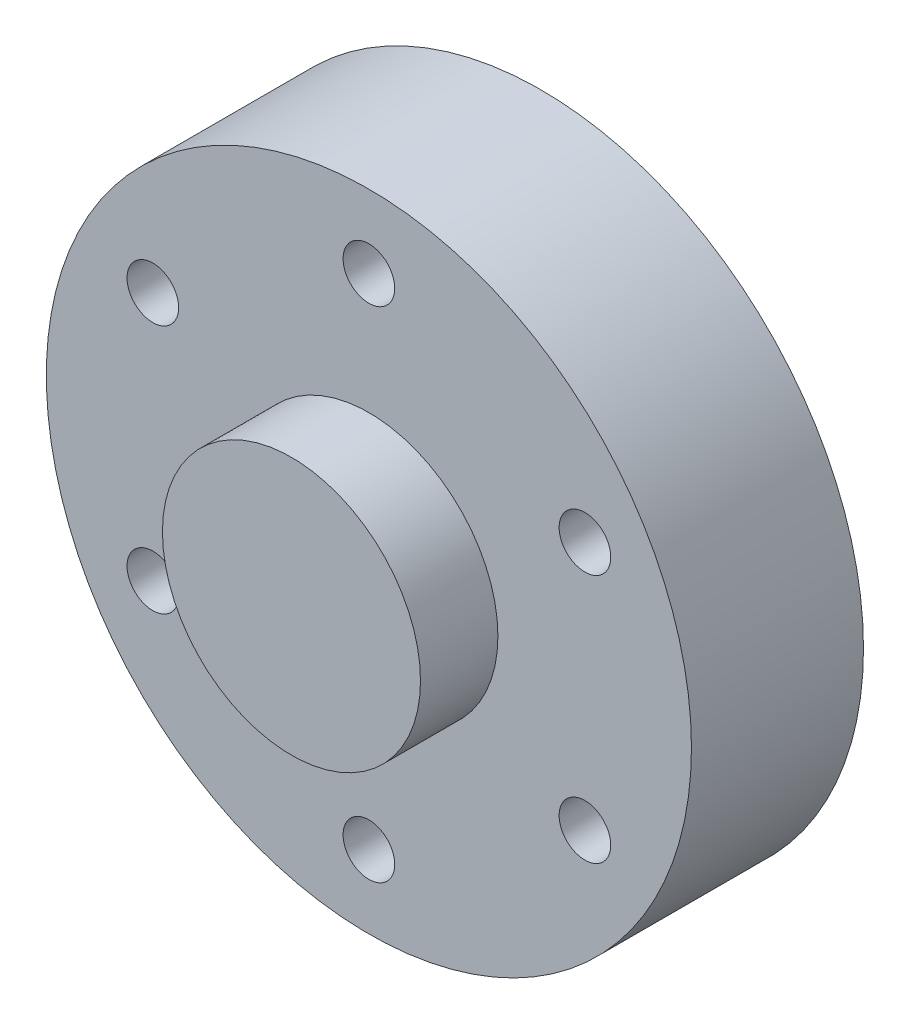
from build123d import *

# Parameters (mm, degrees)
SKETCH2_R           = 18.75
SKETCH2_R_2         = 1.5
BOSS_EXTRUDE1_DEPTH = 10
SKETCH3_R           = 7.5
BOSS_EXTRUDE2_DEPTH = 4.5
BOSS_EXTRUDE4_START = 4.5
SKETCH6_R           = 7.5
BOSS_EXTRUDE4_DEPTH = 4.5
SKETCH7_R           = 2
BOSS_EXTRUDE5_DEPTH = 1
FILLET2_R           = 0.05
CUT_EXTRUDE1_DEPTH  = 11


with BuildPart() as part:
    # Sketch2 → Boss-Extrude1 (new body)
    with BuildSketch(Plane.XY):
        Circle(SKETCH2_R)
        with Locations((0, -14.5)):
            Circle(SKETCH2_R_2, mode=Mode.SUBTRACT)
        with Locations((-12.557368355, -7.25)):
            Circle(SKETCH2_R_2, mode=Mode.SUBTRACT)
        with Locations((12.557368355, -7.25)):
            Circle(SKETCH2_R_2, mode=Mode.SUBTRACT)
        with Locations((-12.557368355, 7.25)):
            Circle(SKETCH2_R_2, mode=Mode.SUBTRACT)
        with Locations((0, 14.5)):
            Circle(SKETCH2_R_2, mode=Mode.SUBTRACT)
        with Locations((12.557368355, 7.25)):
            Circle(SKETCH2_R_2, mode=Mode.SUBTRACT)
    extrude(amount=BOSS_EXTRUDE1_DEPTH)

    # Sketch3 → Boss-Extrude2 (add)
    with BuildSketch(Plane.XY.offset(10)):
        Circle(SKETCH3_R)
    extrude(amount=BOSS_EXTRUDE2_DEPTH)

    # Sketch6 → Boss-Extrude4 (add)
    with BuildSketch(Plane(origin=(0, 0, 0), x_dir=(-1, 0, 0), z_dir=(0, 0, -1)).offset(BOSS_EXTRUDE4_START)):
        Circle(SKETCH6_R)
    extrude(amount=-BOSS_EXTRUDE4_DEPTH)

    # Sketch7 → Boss-Extrude5 (add)
    with BuildSketch(Plane(origin=(0, 0, -4.5), x_dir=(-1, 0, 0), z_dir=(0, 0, -1))):
        Circle(SKETCH7_R)
    extrude(amount=BOSS_EXTRUDE5_DEPTH)

    # Fillet2
    fillet2_edges = [part.edges().sort_by_distance(p)[0] for p in [
        (2, 0, -5.5),
    ]]
    fillet(fillet2_edges, radius=FILLET2_R)

    # Sketch9 → Cut-Extrude1 (cut)
    with BuildSketch(Plane(origin=(0, 0, -5.5), x_dir=(-1, 0, 0), z_dir=(0, 0, -1))):
        with BuildLine():
            Line((-1.224744871, 1.25), (1.224744871, 1.25))
            ThreePointArc((1.224744871, 1.25), (0, -1.75), (-1.224744871, 1.25))
        make_face()
    extrude(amount=-CUT_EXTRUDE1_DEPTH, mode=Mode.SUBTRACT)


solid = part.part
